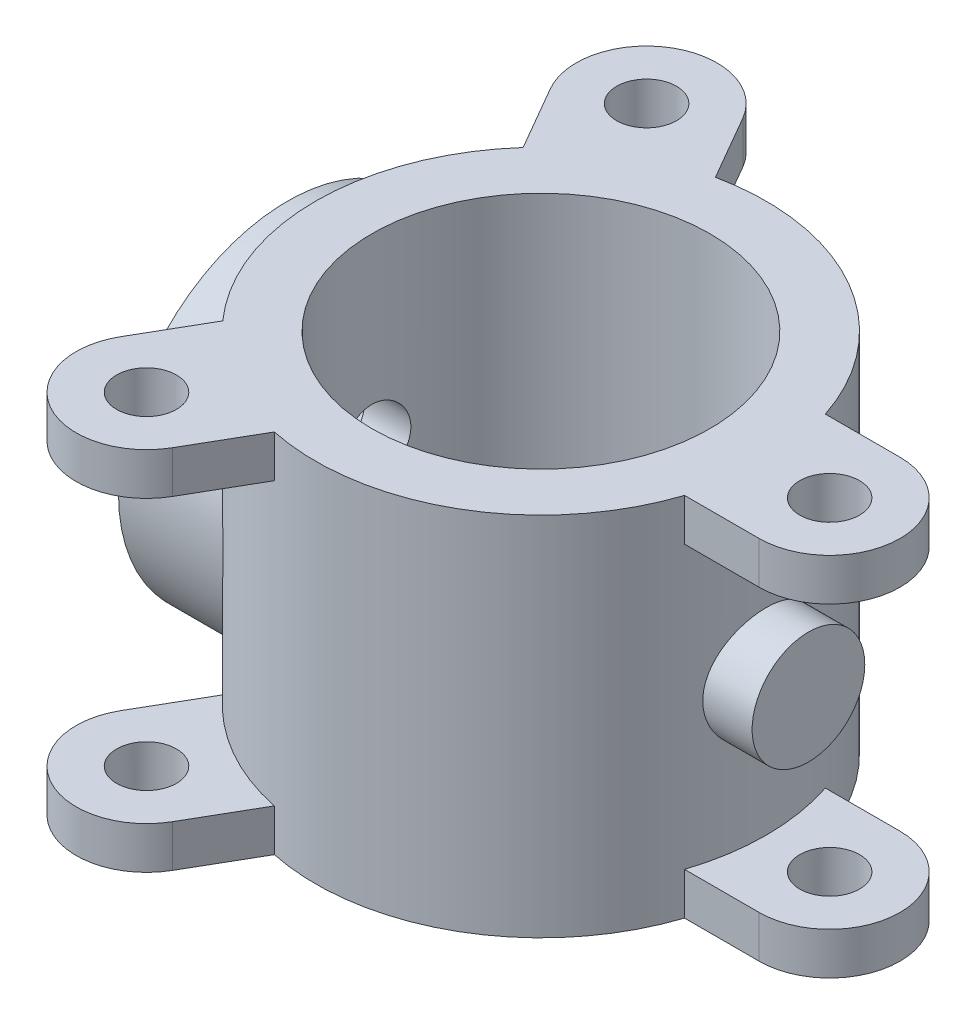
from build123d import *

# Parameters (mm, degrees)
SKETCH1_R                   = 50.8
OUTSIDE_CYLINDER_DEPTH      = 41.275
BORE_START                  = -41.275
BORE_OUTLINE_R              = 38.1
BORE_DEPTH                  = 82.55
TAB_DEPTH                   = 9.525
TAB_HOLE_START              = 31.75
TAB_HOLE_OUTLINE_R          = 6.7437
TAB_HOLE_DEPTH              = 9.525
CIRPATTERN1_COUNT           = 3
MIRROR1_COPY_1_DEPTH        = 9.525
MIRROR1_COPY_2_DEPTH        = 9.525
MIRROR1_START               = 31.75
MIRROR1_COPY_3_SKETCH_R     = 6.7437
MIRROR1_COPY_3_DEPTH        = 9.525
MIRROR1_COPY_4_SKETCH_R     = 6.7437
MIRROR1_COPY_4_DEPTH        = 9.525
LEFT_PROTRUSION_REACH       = 163.254
LEFT_PROTRUSION_END_RADIUS  = 50.8
SKETCH5_R                   = 38.1
RIGHT_PROTRUSION_REACH      = 178.433
RIGHT_PROTRUSION_END_RADIUS = 50.8
RIGHT_START                 = 60.325
SKETCH6_R                   = 12.7
NARROW_START                = -57.15
NARROW_HOLE_OUTLINE_R       = 7.9375
NARROW_HOLE_DEPTH           = 114.3
SHALLOW_START               = -57.15
SHALLOW_HOLE_OUTLINE_R      = 15.875
SHALLOW_HOLE_OUTLINE_R_2    = 7.9375
SHALLOW_HOLE_DEPTH          = 9.525
CIRPATTERN2_COUNT           = 3


# Read off the part's stored shape, not the designer's step: Bore, Tab-hole, Narrow Hole, Shallow Hole
with BuildPart() as part:
    # Sketch1 → Outside Cylinder (new, symmetric)
    with BuildSketch(Plane(origin=(0, 0, 0), x_dir=(1, 0, 0), z_dir=(0, 1, 0))):
        with Locations(Location((0, 0, 0), (0, 0, 270))):
            Circle(SKETCH1_R)
    extrude(amount=OUTSIDE_CYLINDER_DEPTH, both=True)

    # Bore outline → Bore (cut)
    with BuildSketch(Plane(origin=(0, 0, 0), x_dir=(1, 0, 0), z_dir=(0, 1, 0)).offset(BORE_START)):
        Circle(BORE_OUTLINE_R)
    extrude(amount=BORE_DEPTH, mode=Mode.SUBTRACT)

    # Sketch3 → tab (add)
    with BuildSketch(Plane(origin=(0, 41.275, 0), x_dir=(1, 0, 0), z_dir=(0, 1, 0))):
        with BuildLine():
            Line((65.1002, 15.875), (48.255822188, 15.875))
            ThreePointArc((48.255822188, 15.875), (50.8, 0), (48.255822188, -15.875))
            Line((48.255822188, -15.875), (65.1002, -15.875))
            ThreePointArc((65.1002, -15.875), (80.9752, 0), (65.1002, 15.875))
        make_face()
    tab = extrude(amount=-TAB_DEPTH)

    # Tab-hole outline → Tab-hole (cut)
    with BuildSketch(Plane(origin=(0, 0, 0), x_dir=(1, 0, 0), z_dir=(0, 1, 0)).offset(TAB_HOLE_START)):
        with Locations((65.1002, 0)):
            Circle(TAB_HOLE_OUTLINE_R)
    tab_hole = extrude(amount=TAB_HOLE_DEPTH, mode=Mode.SUBTRACT)

    # CirPattern1: tab, Tab-hole ×3 about axis
    cirpattern1_axis = Axis((0, 0, 0), (0, 1, 0))
    add([tab.rotate(cirpattern1_axis, i * 360 / CIRPATTERN1_COUNT) for i in range(1, CIRPATTERN1_COUNT)])
    add([tab_hole.rotate(cirpattern1_axis, i * 360 / CIRPATTERN1_COUNT) for i in range(1, CIRPATTERN1_COUNT)], mode=Mode.SUBTRACT)

    # Mirror1: tab, Tab-hole across plane
    add(tab.mirror(Plane.ZX))
    add(tab_hole.mirror(Plane.ZX), mode=Mode.SUBTRACT)

    # Mirror1 copy 1 sketch → Mirror1 copy 1 (add)
    with BuildSketch(Plane(origin=(0, -41.275, 0), x_dir=(-0.4999999999999998, 0, -0.8660254037844387), z_dir=(0, -1, 0))):
        with BuildLine():
            Line((65.1002, -15.875), (48.255822188, -15.875))
            ThreePointArc((48.255822188, -15.875), (50.8, 0), (48.255822188, 15.875))
            Line((48.255822188, 15.875), (65.1002, 15.875))
            ThreePointArc((65.1002, 15.875), (80.9752, 0), (65.1002, -15.875))
        make_face()
    extrude(amount=-MIRROR1_COPY_1_DEPTH)

    # Mirror1 copy 2 sketch → Mirror1 copy 2 (add)
    with BuildSketch(Plane(origin=(0, -41.275, 0), x_dir=(-0.5000000000000004, 0, 0.8660254037844384), z_dir=(0, -1, 0))):
        with BuildLine():
            Line((65.1002, -15.875), (48.255822188, -15.875))
            ThreePointArc((48.255822188, -15.875), (50.8, 0), (48.255822188, 15.875))
            Line((48.255822188, 15.875), (65.1002, 15.875))
            ThreePointArc((65.1002, 15.875), (80.9752, 0), (65.1002, -15.875))
        make_face()
    extrude(amount=-MIRROR1_COPY_2_DEPTH)

    # Mirror1 copy 3 sketch → Mirror1 copy 3 (cut)
    with BuildSketch(Plane(origin=(0, 0, 0), x_dir=(-0.4999999999999998, 0, -0.8660254037844387), z_dir=(0, -1, 0)).offset(MIRROR1_START)):
        with Locations((65.1002, 0)):
            Circle(MIRROR1_COPY_3_SKETCH_R)
    extrude(amount=MIRROR1_COPY_3_DEPTH, mode=Mode.SUBTRACT)

    # Mirror1 copy 4 sketch → Mirror1 copy 4 (cut)
    with BuildSketch(Plane(origin=(0, 0, 0), x_dir=(-0.5000000000000004, 0, 0.8660254037844384), z_dir=(0, -1, 0)).offset(MIRROR1_START)):
        with Locations((65.1002, 0)):
            Circle(MIRROR1_COPY_4_SKETCH_R)
    extrude(amount=MIRROR1_COPY_4_DEPTH, mode=Mode.SUBTRACT)

    # Left Protrusion: up to this cylinder (the profile starts outside it)
    left_protrusion_end = Plane(origin=(0, 0, 0), z_dir=(0, -1, 0)) * Cylinder(LEFT_PROTRUSION_END_RADIUS, 429.108, mode=Mode.PRIVATE)
    # Sketch5 → Left Protrusion (add, up to the surface)
    with BuildSketch(Plane(origin=(-57.15, 0, 0), x_dir=(0, 0, -1), z_dir=(1, 0, 0)), mode=Mode.PRIVATE) as left_protrusion_sk1:
        with Locations(Location((0, 0, 0), (0, 0, 180))):
            Circle(SKETCH5_R)
    left_protrusion_tool1 = extrude(left_protrusion_sk1.sketch, amount=LEFT_PROTRUSION_REACH, mode=Mode.PRIVATE) - left_protrusion_end
    add(left_protrusion_tool1.solids().sort_by_distance((-57.15, 0, 0))[0])

    # Right Protrusion: up to this cylinder (the profile starts outside it)
    right_protrusion_end = Plane(origin=(0, 0, 0), z_dir=(0, -1, 0)) * Cylinder(RIGHT_PROTRUSION_END_RADIUS, 459.466, mode=Mode.PRIVATE)
    # Sketch6 → Right Protrusion (add, up to the surface)
    with BuildSketch(Plane(origin=(0, 0, 0), x_dir=(0, 0, -1), z_dir=(1, 0, 0)).offset(RIGHT_START), mode=Mode.PRIVATE) as right_protrusion_sk1:
        Circle(SKETCH6_R)
    right_protrusion_tool1 = extrude(right_protrusion_sk1.sketch, amount=-RIGHT_PROTRUSION_REACH, mode=Mode.PRIVATE) - right_protrusion_end
    add(right_protrusion_tool1.solids().sort_by_distance((60.325, 0, 0))[0])

    # Narrow Hole outline → Narrow Hole (cut)
    with BuildSketch(Plane.YZ.offset(NARROW_START)):
        Circle(NARROW_HOLE_OUTLINE_R)
    extrude(amount=NARROW_HOLE_DEPTH, mode=Mode.SUBTRACT)

    # Shallow Hole outline → Shallow Hole (cut)
    with BuildSketch(Plane.YZ.offset(SHALLOW_START)):
        Circle(SHALLOW_HOLE_OUTLINE_R)
        Circle(SHALLOW_HOLE_OUTLINE_R_2, mode=Mode.SUBTRACT)
    extrude(amount=SHALLOW_HOLE_DEPTH, mode=Mode.SUBTRACT)

    # Sketch13 → 3/8-16 Tapped Hole2 (revolve, cut)
    with BuildSketch(Plane(origin=(-57.15, -13.49502, 23.374060289), x_dir=(0, 0, 1), z_dir=(0, 1, 0))):
        Polygon((0, 0), (0, 17.624665582), (3.96875, 15.24), (3.96875, 0), align=None)
    f_3_8_16_tapped_hole2 = revolve(axis=Axis((-63.5, -13.49502, 23.374060289), (1, 0, 0)), mode=Mode.SUBTRACT)

    # CirPattern2: 3/8-16 Tapped Hole2 ×3 about axis
    cirpattern2_axis = Axis((0, 0, 0), (1, 0, 0))
    for i in range(1, CIRPATTERN2_COUNT):
        add(f_3_8_16_tapped_hole2.rotate(cirpattern2_axis, i * 360 / CIRPATTERN2_COUNT), mode=Mode.SUBTRACT)


solid = part.part
